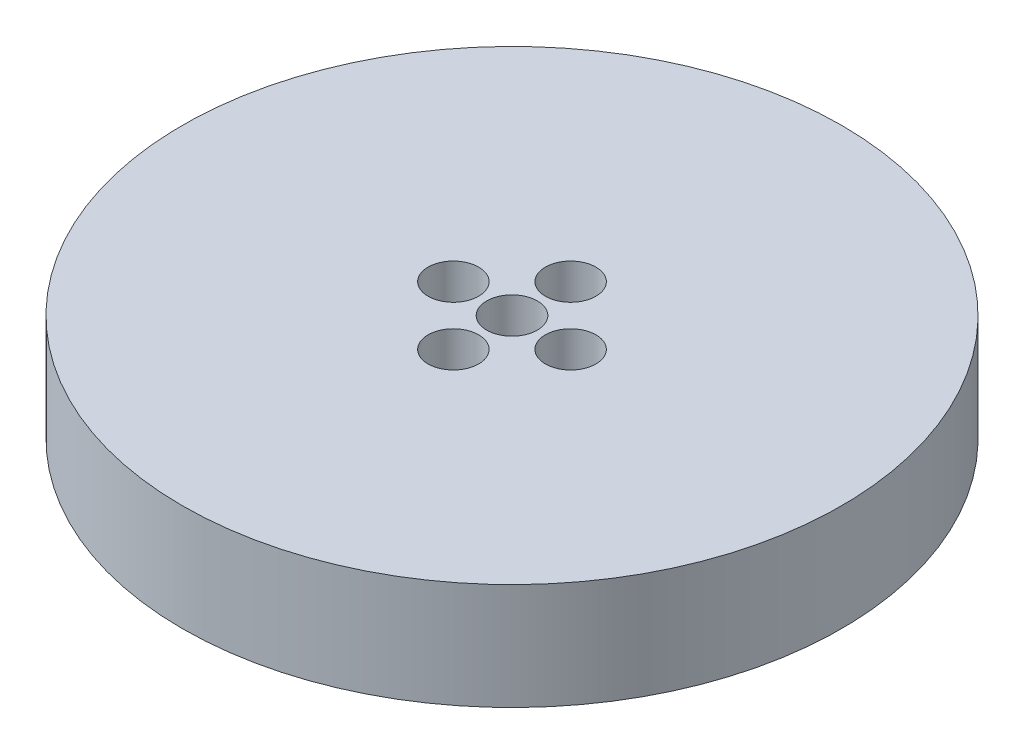
from build123d import *

# Parameters (mm, degrees)
SKETCH1_R           = 65
BOSS_EXTRUDE1_DEPTH = 21
SKETCH2_R           = 5
CUT_EXTRUDE1_DEPTH  = 95.292099351
SKETCH3_R           = 4.986792835
CUT_EXTRUDE2_DEPTH  = 18.006440071
CIRPATTERN1_COUNT   = 4


with BuildPart() as part:
    # Sketch1 → Boss-Extrude1 (new body)
    with BuildSketch(Plane(origin=(0, 0, 0), x_dir=(1, 0, 0), z_dir=(0, 1, 0))):
        Circle(SKETCH1_R)
    extrude(amount=BOSS_EXTRUDE1_DEPTH)

    # Sketch2 → Cut-Extrude1 (cut, through all)
    with BuildSketch(Plane(origin=(0, 0, 0), x_dir=(1, 0, 0), z_dir=(0, 1, 0))):
        Circle(SKETCH2_R)
    extrude(amount=CUT_EXTRUDE1_DEPTH, mode=Mode.SUBTRACT)

    # Sketch3 → Cut-Extrude2 (cut)
    with BuildSketch(Plane(origin=(0, 21, 0), x_dir=(1, 0, 0), z_dir=(0, 1, 0))):
        with Locations((-11.56687807, 0)):
            Circle(SKETCH3_R)
    cut_extrude2 = extrude(amount=-CUT_EXTRUDE2_DEPTH, mode=Mode.SUBTRACT)

    # CirPattern1: Cut-Extrude2 ×4 about axis
    cirpattern1_axis = Axis((0, 0, 0), (0, 1, 0))
    for i in range(1, CIRPATTERN1_COUNT):
        add(cut_extrude2.rotate(cirpattern1_axis, i * 360 / CIRPATTERN1_COUNT), mode=Mode.SUBTRACT)


solid = part.part
